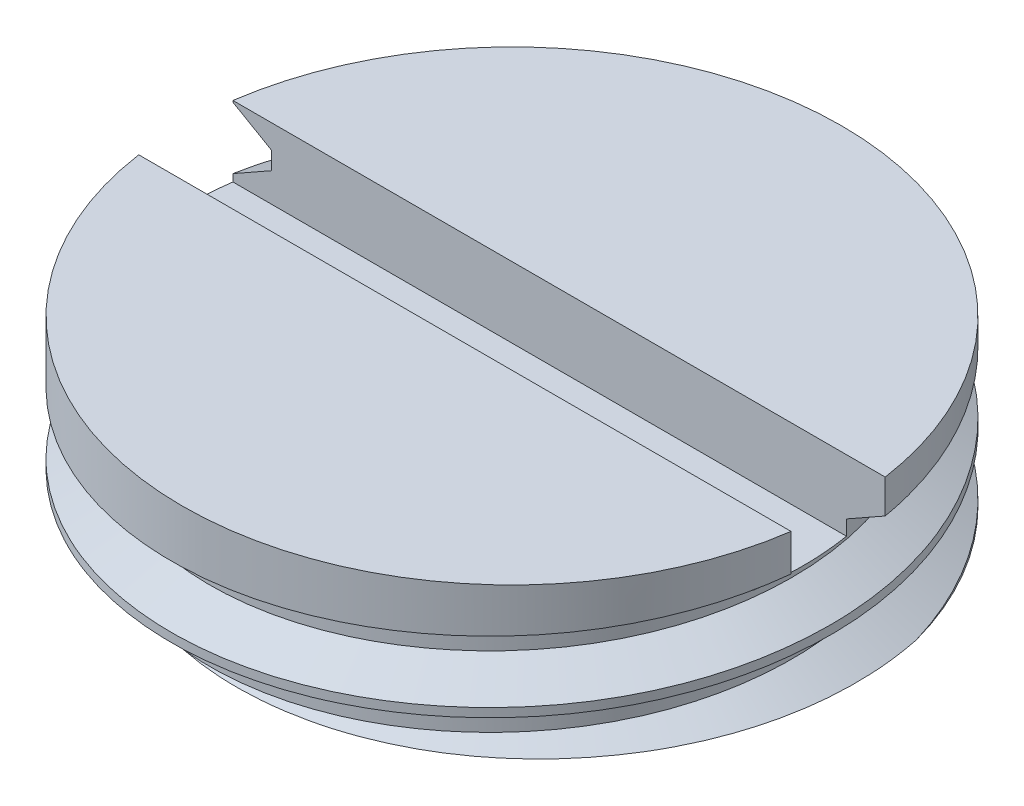
from build123d import *

# Parameters (mm, degrees)
SKETCH_1_R               = 7
EXTRUDE_1_DEPTH          = 3.5
THREAD_1_PITCH           = 1.5
CUT_EXTRUDE_1_DEPTH      = 11.5000004
CUT_EXTRUDE_1_DEPTH_BACK = 11.5000004
SKETCH_4_W               = 2
SKETCH_4_H               = 1.5


with BuildPart() as part:
    # Sketch 1 → Бобышка-Вытянуть1 (new body)
    with BuildSketch(Plane(origin=(0, 0, 0), x_dir=(1, 0, 0), z_dir=(0, 1, 0))):
        with Locations(Location((0, 0, 0), (0, 0, 270))):
            Circle(SKETCH_1_R)
    extrude(amount=EXTRUDE_1_DEPTH)

    # Резьба1: the profile of Sketch 1 2 profile screwed along a right-hand helix of 2.333333 turns, 8 arcs to a turn; built about Z, then put on its axis
    thread_1_z = Axis((0, 0, 0), (0, 0, 1))
    thread_1_corners = [(7.0003, 0, -0.000173205), (7.0003, 0, 1.312673201), (6.188101188, 0, 0.843749998), (6.188101188, 0, 0.468749998)]
    with BuildLine(mode=Mode.PRIVATE) as thread_1_profile:
        Line(thread_1_corners[0], thread_1_corners[1])
        Line(thread_1_corners[1], thread_1_corners[2])
        Line(thread_1_corners[2], thread_1_corners[3])
        Line(thread_1_corners[3], thread_1_corners[0])
    thread_1_cap = Face(thread_1_profile.wire())
    thread_1_turn_angles = [0, 22.5, 45, 67.5, 90, 112.5, 135, 157.5, 180, 202.5, 225, 247.5, 270, 292.5, 315, 337.5, 360]
    thread_1_turn_weights = [1, 0.9238795325112867, 1, 0.9238795325112867, 1, 0.9238795325112867, 1, 0.9238795325112867, 1, 0.9238795325112867, 1, 0.9238795325112867, 1, 0.9238795325112867, 1, 0.9238795325112867, 1]
    thread_1_turn_rails = [Edge.make_bspline([Vector(p[0], p[1], 0).rotate(thread_1_z, thread_1_turn_angles[k]) / thread_1_turn_weights[k] + Vector(0, 0, p[2] + THREAD_1_PITCH * thread_1_turn_angles[k] / 360) for k in range(17)], [0, 0, 0, 1, 1, 2, 2, 3, 3, 4, 4, 5, 5, 6, 6, 7, 7, 8, 8, 8], 2, thread_1_turn_weights) for p in thread_1_corners]
    thread_1_turn_sides = [Face.make_surface_from_curves(thread_1_turn_rails[p[0]], thread_1_turn_rails[p[1]]) for p in [(0, 1), (1, 2), (2, 3), (3, 0)]]
    thread_1_last_angles = [720, 742.5, 765, 787.5, 810, 825, 840]
    thread_1_last_weights = [1, 0.9238795325112867, 1, 0.9238795325112867, 1, 0.9659258262890685, 1]
    thread_1_last_rails = [Edge.make_bspline([Vector(p[0], p[1], 0).rotate(thread_1_z, thread_1_last_angles[k]) / thread_1_last_weights[k] + Vector(0, 0, p[2] + THREAD_1_PITCH * thread_1_last_angles[k] / 360) for k in range(7)], [0, 0, 0, 1, 1, 2, 2, 3, 3, 3], 2, thread_1_last_weights) for p in thread_1_corners]
    thread_1_last_sides = [Face.make_surface_from_curves(thread_1_last_rails[p[0]], thread_1_last_rails[p[1]]) for p in [(0, 1), (1, 2), (2, 3), (3, 0)]]
    thread_1 = Plane(origin=(0, 3.5, 0), x_dir=(-1, 0, 0), z_dir=(0, -1, 0)) * Solid(Shell([*[p.moved(Location((0, 0, THREAD_1_PITCH * i))) for i in range(2) for p in thread_1_turn_sides], *thread_1_last_sides, thread_1_cap, thread_1_cap.rotate(thread_1_z, 840).moved(Location((0, 0, THREAD_1_PITCH * 840 / 360)))]))
    add(thread_1, mode=Mode.SUBTRACT)

    # Эскиз4 → Вырез-Вытянуть1 (cut, two sides: drawn at the far end of the back side and taken through both)
    with BuildSketch(Plane(origin=(0, 0, 0), x_dir=(0, 0, -1), z_dir=(1, 0, 0)).offset(-CUT_EXTRUDE_1_DEPTH_BACK)):
        with Locations((0, 2.75)):
            Rectangle(SKETCH_4_W, SKETCH_4_H)
    extrude(amount=CUT_EXTRUDE_1_DEPTH + CUT_EXTRUDE_1_DEPTH_BACK, mode=Mode.SUBTRACT)


solid = part.part
